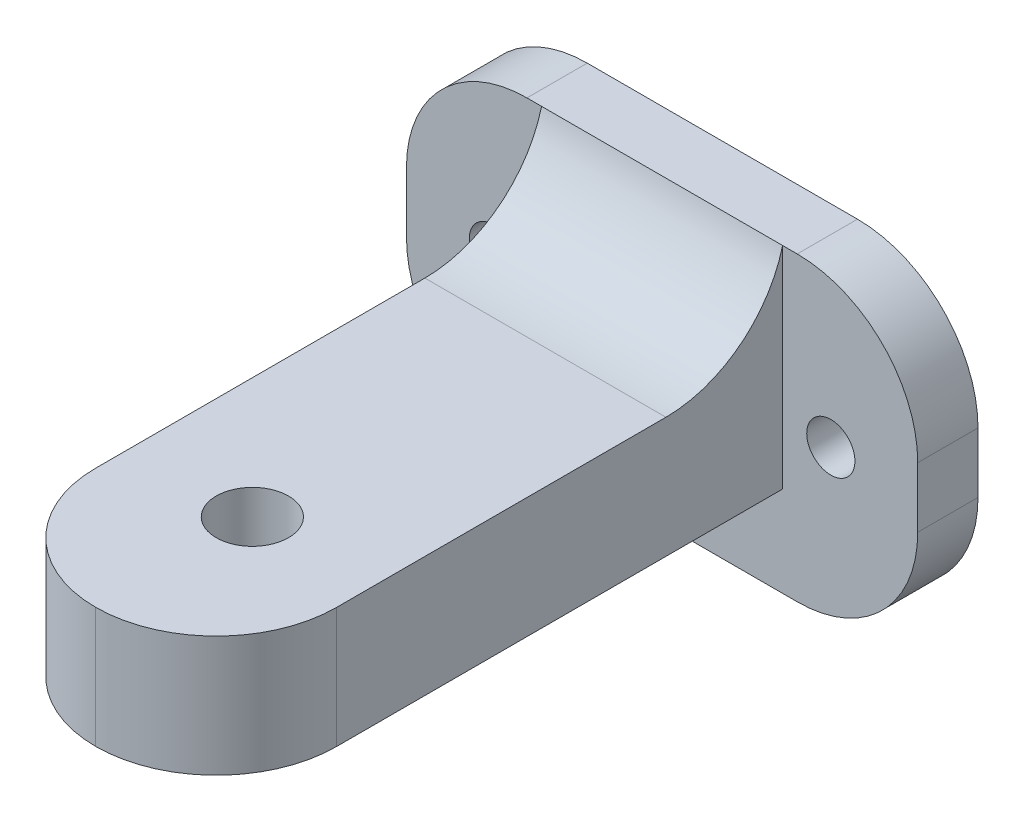
from build123d import *

# Parameters (mm, degrees)
SKETCH1_W           = 42.425590724
SKETCH1_H           = 25
SKETCH1_R           = 2
BOSS_EXTRUDE1_DEPTH = 5
FILLET1_R           = 10
SKETCH2_W           = 20
SKETCH2_H           = 10
BOSS_EXTRUDE2_DEPTH = 47
SKETCH3_R           = 5.25
CUT_EXTRUDE1_DEPTH  = 5
SKETCH4_R           = 3
CUT_EXTRUDE2_DEPTH  = 5
FILLET2_R           = 10


with BuildPart() as part:
    # Sketch1 → Boss-Extrude1 (new body)
    with BuildSketch(Plane.XY):
        Rectangle(SKETCH1_W, SKETCH1_H)
        with Locations((-14, 0)):
            Circle(SKETCH1_R, mode=Mode.SUBTRACT)
        with Locations(Location((14, 0, 0), (0, 0, 180))):
            Circle(SKETCH1_R, mode=Mode.SUBTRACT)
    extrude(amount=BOSS_EXTRUDE1_DEPTH)

    # Fillet1
    fillet1_edges = [part.edges().sort_by_distance(p)[0] for p in [
        (-21.212795362, 12.5, 2.5),
        (21.212795362, 12.5, 2.5),
        (21.212795362, -12.5, 2.5),
        (-21.212795362, -12.5, 2.5),
    ]]
    fillet(fillet1_edges, radius=FILLET1_R)

    # Sketch2 → Boss-Extrude2 (add)
    with BuildSketch(Plane.XY.offset(5)):
        Rectangle(SKETCH2_W, SKETCH2_H)
    extrude(amount=BOSS_EXTRUDE2_DEPTH)

    # Sketch3 → Cut-Extrude1 (cut)
    with BuildSketch(Plane.XZ.offset(5)):
        with Locations((0, 39)):
            Circle(SKETCH3_R)
    extrude(amount=-CUT_EXTRUDE1_DEPTH, mode=Mode.SUBTRACT)

    # Sketch4 → Cut-Extrude2 (cut)
    with BuildSketch(Plane.XZ):
        with Locations((0, 39)):
            Circle(SKETCH4_R)
    extrude(amount=-CUT_EXTRUDE2_DEPTH, mode=Mode.SUBTRACT)

    # Fillet2
    # the kernel refuses this fillet: 10 mm, written as the material it adds along each edge
    with BuildSketch(Plane(origin=(-10, 5, 5), x_dir=(0, 1, 0), z_dir=(1, 0, 0))) as fillet2_piece_1:
        with BuildLine():
            CenterArc((10, 9.682458366), FILLET2_R, 180, 75.522487814)
            Line((0, 9.682458366), (0, 0))
            Line((0, 0), (7.5, 0))
        make_face()
    extrude(amount=20)
    # the kernel refuses this fillet: 10 mm, written as the material it takes off along each edge
    with BuildSketch(Plane(origin=(-10, -30, 52), x_dir=(1, 0, 0), z_dir=(0, 1, 0))) as fillet2_2_piece_1:
        with BuildLine():
            CenterArc((FILLET2_R, FILLET2_R), FILLET2_R, 180, 90)
            Line((0, FILLET2_R), (0, 0))
            Line((0, 0), (FILLET2_R, 0))
        make_face()
    extrude(amount=60, mode=Mode.SUBTRACT)
    with BuildSketch(Plane(origin=(10, 30, 52), x_dir=(0, 0, -1), z_dir=(0, -1, 0))) as fillet2_2_piece_2:
        with BuildLine():
            CenterArc((FILLET2_R, -FILLET2_R), FILLET2_R, 90, 90)
            Line((0, -FILLET2_R), (0, 0))
            Line((0, 0), (FILLET2_R, 0))
        make_face()
    extrude(amount=60, mode=Mode.SUBTRACT)


solid = part.part
